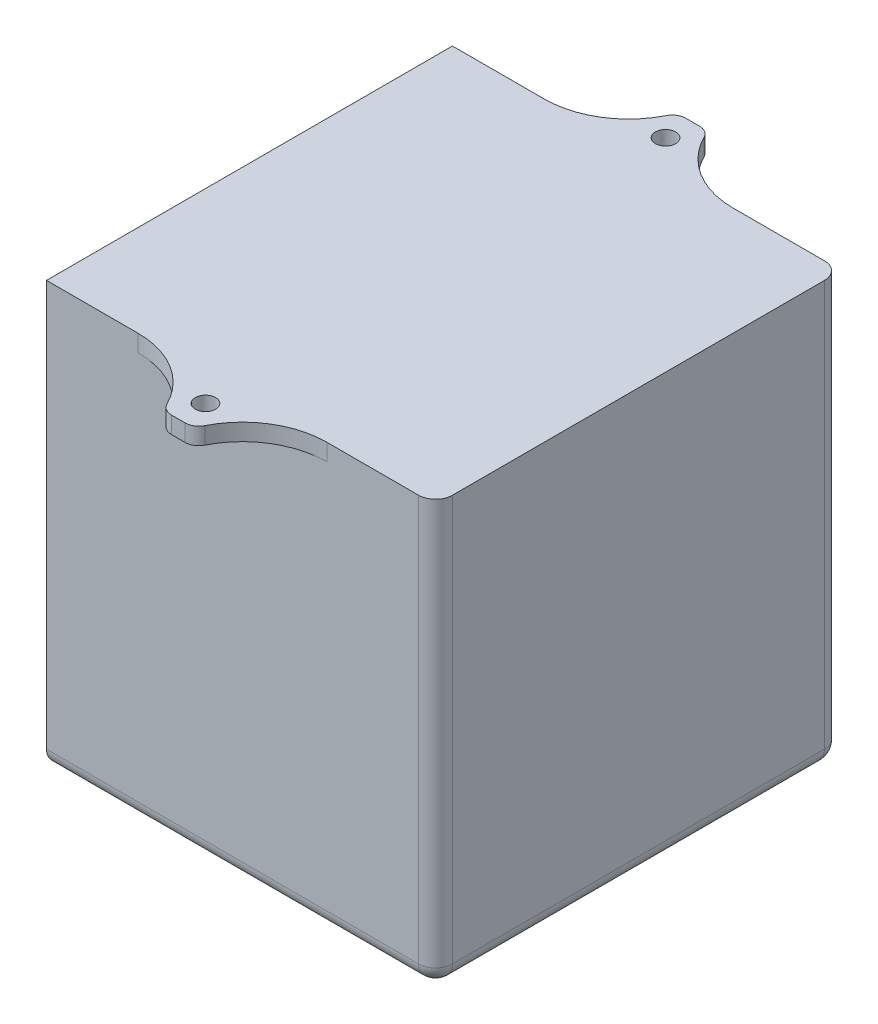
from build123d import *

# Parameters (mm, degrees)
SKETCH1_W           = 60
SKETCH1_H           = 60
BOSS_EXTRUDE1_DEPTH = 60
SHELL1_T            = -2.5
SKETCH5_R           = 1.5
BOSS_EXTRUDE3_DEPTH = 2.5
SKETCH6_W           = 60
SKETCH6_H           = 60
BOSS_EXTRUDE4_DEPTH = 2.5
SKETCH7_W           = 60
SKETCH7_H           = 62.5
CUT_EXTRUDE1_DEPTH  = 2.5
FILLET4_R           = 2.5
FILLET5_R           = 12.5
FILLET6_R           = 2.5


with BuildPart() as part:
    # Sketch1 → Boss-Extrude1 (new body)
    with BuildSketch(Plane(origin=(0, 0, 0), x_dir=(1, 0, 0), z_dir=(0, 1, 0))):
        with Locations((30, 30)):
            Rectangle(SKETCH1_W, SKETCH1_H)
    extrude(amount=BOSS_EXTRUDE1_DEPTH)

    # Shell1
    shell1_openings = [part.faces().sort_by_distance(p)[0] for p in [
        (30, 0, -30),
    ]]
    offset(amount=SHELL1_T, openings=shell1_openings, kind=Kind.INTERSECTION)

    # Sketch5 → Boss-Extrude3 (add)
    # profile 1 of 2: a face of its own
    with BuildSketch(Plane(origin=(0, 60, 0), x_dir=(1, 0, 0), z_dir=(0, 1, 0))):
        with BuildLine():
            Line((27, 60), (27, 66))
            ThreePointArc((27, 66), (27.585786438, 67.414213562), (29, 68))
            Line((29, 68), (31, 68))
            ThreePointArc((31, 68), (32.414213562, 67.414213562), (33, 66))
            Line((33, 66), (33, 60))
            Line((33, 60), (27, 60))
        make_face()
        with Locations(Location((30, 64, 0), (0, 0, 270))):
            Circle(SKETCH5_R, mode=Mode.SUBTRACT)
    # profile 2 of 2: a face of its own
    with BuildSketch(Plane(origin=(0, 60, 0), x_dir=(1, 0, 0), z_dir=(0, 1, 0))):
        with BuildLine():
            Line((33, 0), (27, 0))
            Line((27, 0), (27, -6))
            ThreePointArc((27, -6), (27.585786438, -7.414213562), (29, -8))
            Line((29, -8), (31, -8))
            ThreePointArc((31, -8), (32.414213562, -7.414213562), (33, -6))
            Line((33, -6), (33, 0))
        make_face()
        with Locations(Location((30, -4, 0), (0, 0, 90))):
            Circle(SKETCH5_R, mode=Mode.SUBTRACT)
    extrude(amount=-BOSS_EXTRUDE3_DEPTH)

    # Sketch6 → Boss-Extrude4 (add)
    with BuildSketch(Plane.XZ):
        with Locations((30, -30)):
            Rectangle(SKETCH6_W, SKETCH6_H)
    extrude(amount=BOSS_EXTRUDE4_DEPTH)

    # Sketch7 → Cut-Extrude1 (cut)
    with BuildSketch(Plane.ZY):
        with Locations((-30, 28.75)):
            Rectangle(SKETCH7_W, SKETCH7_H)
    extrude(amount=-CUT_EXTRUDE1_DEPTH, mode=Mode.SUBTRACT)

    # Fillet4
    fillet4_edges = [part.edges().sort_by_distance(p)[0] for p in [
        (31.25, -2.5, 0),
        (60, -2.5, -30),
        (31.25, -2.5, -60),
        (60, 28.75, -60),
        (60, 28.75, 0),
    ]]
    fillet(fillet4_edges, radius=FILLET4_R)

    # Fillet5
    # the kernel refuses this fillet: 12.5 mm, written as the material it adds along each edge
    with BuildSketch(Plane(origin=(27, 60, 0), x_dir=(-1, 0, 0), z_dir=(0, -1, 0)), Plane(origin=(33, 60, -60), x_dir=(1, 0, 0), z_dir=(0, -1, 0))) as fillet5_piece_1:
        with BuildLine():
            CenterArc((10.961481397, -12.5), FILLET5_R, 90, 63.366881251)
            Line((-0.212209463, -6.896551724), (-1.329578548, -6.336206897))
            ThreePointArc((-1.329578548, -6.336206897), (-1.25, -6), (-1.25, 0))
            Line((-1.25, 0), (0, 1.25))
            Line((0, 1.25), (10.961481397, 1.25))
            Line((10.961481397, 1.25), (10.961481397, 0))
        make_face()
    extrude(amount=2.5)
    with BuildSketch(Plane(origin=(33, 60, 0), x_dir=(1, 0, 0), z_dir=(0, -1, 0)), Plane(origin=(27, 60, -60), x_dir=(-1, 0, 0), z_dir=(0, -1, 0))) as fillet5_piece_2:
        with BuildLine():
            CenterArc((10.961481397, 12.5), FILLET5_R, 206.633118749, 63.366881251)
            Line((-0.212209463, 6.896551724), (-1.329578548, 6.336206897))
            ThreePointArc((-1.329578548, 6.336206897), (-1.25, 6), (-1.25, 0))
            Line((-1.25, 0), (0, -1.25))
            Line((0, -1.25), (10.961481397, -1.25))
            Line((10.961481397, -1.25), (10.961481397, 0))
        make_face()
    extrude(amount=2.5)

    # Fillet6
    fillet6_edges = [part.edges().sort_by_distance(p)[0] for p in [
        (30, 0, -2.5),
        (57.5, 0, -30),
        (57.5, 28.75, -2.5),
        (30, 0, -57.5),
        (57.5, 28.75, -57.5),
        (30, 57.5, -2.5),
        (57.5, 57.5, -30),
        (30, 57.5, -57.5),
    ]]
    fillet(fillet6_edges, radius=FILLET6_R)


solid = part.part
